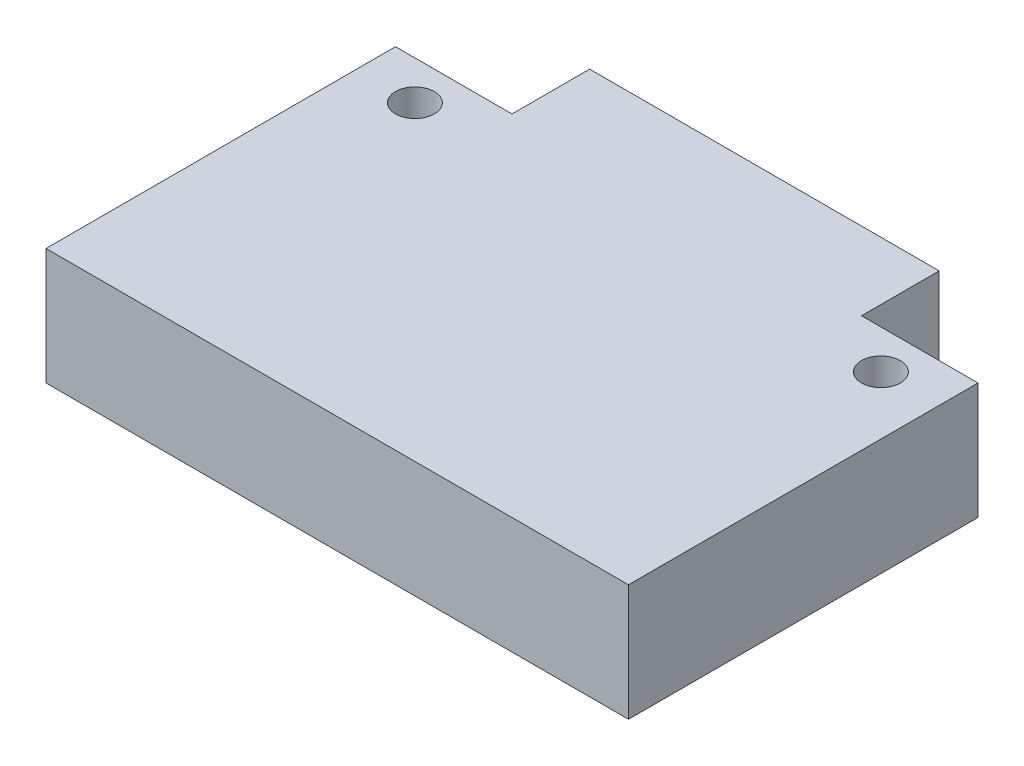
from build123d import *

# Parameters (mm, degrees)
BOSS_EXTRUDE1_DEPTH = 6
SKETCH2_R           = 1
CUT_EXTRUDE1_DEPTH  = 38.682887363


with BuildPart() as part:
    # Sketch1 → Boss-Extrude1 (new body)
    with BuildSketch(Plane(origin=(0, 0, 0), x_dir=(1, 0, 0), z_dir=(0, 1, 0))):
        Polygon((0, 18), (6, 18), (6, 22), (24, 22), (24, 18), (30, 18), (30, 0), (0, 0), align=None)
    extrude(amount=BOSS_EXTRUDE1_DEPTH)

    # Sketch2 → Cut-Extrude1 (cut, through all)
    with BuildSketch(Plane(origin=(0, 6, 0), x_dir=(1, 0, 0), z_dir=(0, 1, 0))):
        with Locations((3, 16)):
            Circle(SKETCH2_R)
        with Locations((27, 16)):
            Circle(SKETCH2_R)
    extrude(amount=-CUT_EXTRUDE1_DEPTH, mode=Mode.SUBTRACT)


solid = part.part
